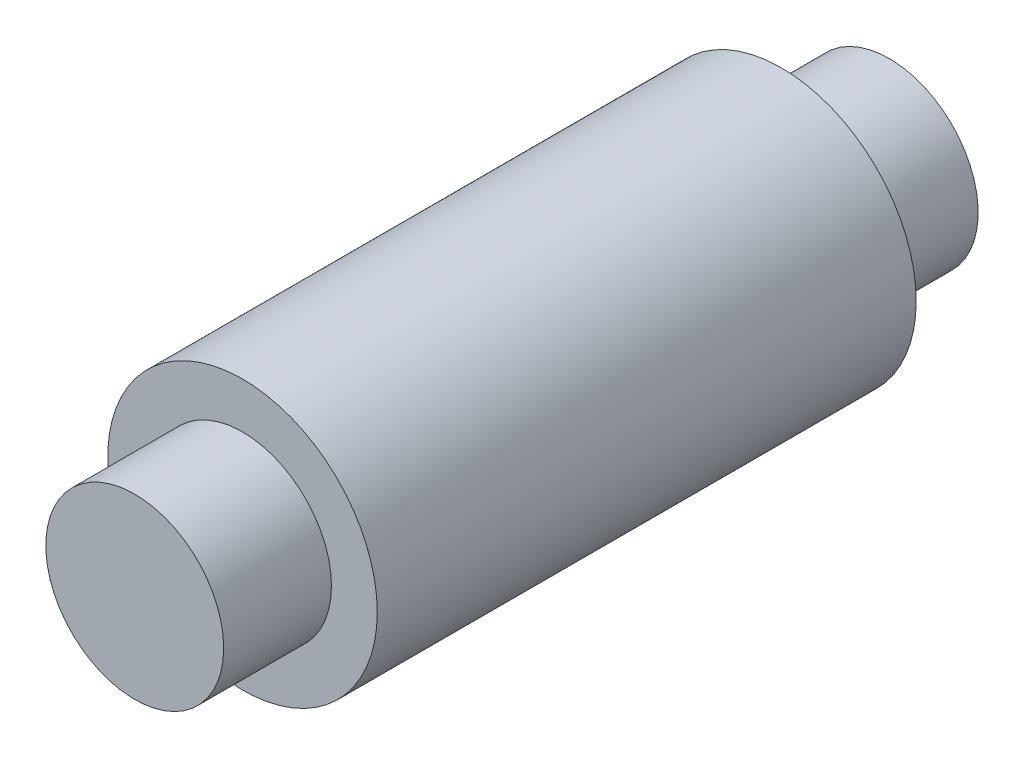
from build123d import *

# Parameters (mm, degrees)
ESQUISSE1_R        = 2.5
BOSS_EXTRU_1_DEPTH = 10
ESQUISSE2_R        = 1.65
BOSS_EXTRU_2_DEPTH = 2
BOSS_EXTRU_3_START = 2
ESQUISSE3_R        = 1.65
BOSS_EXTRU_3_DEPTH = 2


with BuildPart() as part:
    # Esquisse1 → Boss.-Extru.1 (new body)
    with BuildSketch(Plane.XY):
        Circle(ESQUISSE1_R)
    extrude(amount=BOSS_EXTRU_1_DEPTH)

    # Esquisse2 → Boss.-Extru.2 (add)
    with BuildSketch(Plane.XY.offset(10)):
        Circle(ESQUISSE2_R)
    extrude(amount=BOSS_EXTRU_2_DEPTH)

    # Esquisse3 → Boss.-Extru.3 (add)
    with BuildSketch(Plane(origin=(0, 0, 0), x_dir=(-1, 0, 0), z_dir=(0, 0, -1)).offset(BOSS_EXTRU_3_START)):
        Circle(ESQUISSE3_R)
    extrude(amount=-BOSS_EXTRU_3_DEPTH)


solid = part.part
